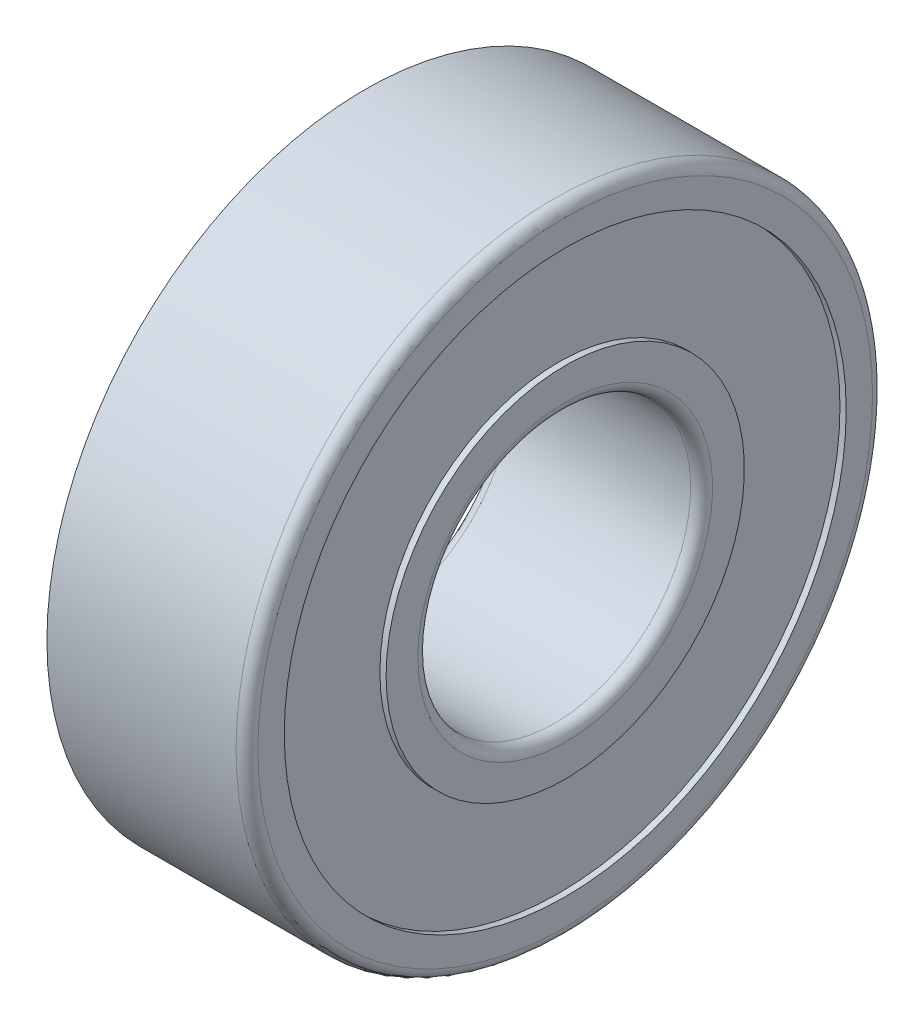
from build123d import *


with BuildPart() as part:
    # 草图1 → 旋转1 (revolve)
    with BuildSketch(Plane.XY):
        with BuildLine():
            Line((0, 17.5), (0, 15.45))
            Line((0, 15.45), (0.342, 15.45))
            Line((0.342, 15.45), (0.342, 9.85))
            Line((0.342, 9.85), (0, 9.85))
            Line((0, 9.85), (0, 8.1))
            ThreePointArc((0, 8.1), (0.175735931, 7.675735931), (0.6, 7.5))
            Line((0.6, 7.5), (10.4, 7.5))
            ThreePointArc((10.4, 7.5), (10.824264069, 7.675735931), (11, 8.1))
            Line((11, 8.1), (11, 9.85))
            Line((11, 9.85), (10.658, 9.85))
            Line((10.658, 9.85), (10.658, 15.45))
            Line((10.658, 15.45), (11, 15.45))
            Line((11, 15.45), (11, 16.9))
            ThreePointArc((11, 16.9), (10.824264069, 17.324264069), (10.4, 17.5))
            Line((10.4, 17.5), (0, 17.5))
        make_face()
    revolve(axis=Axis((11, 0, 0), (-1, 0, 0)))


solid = part.part
